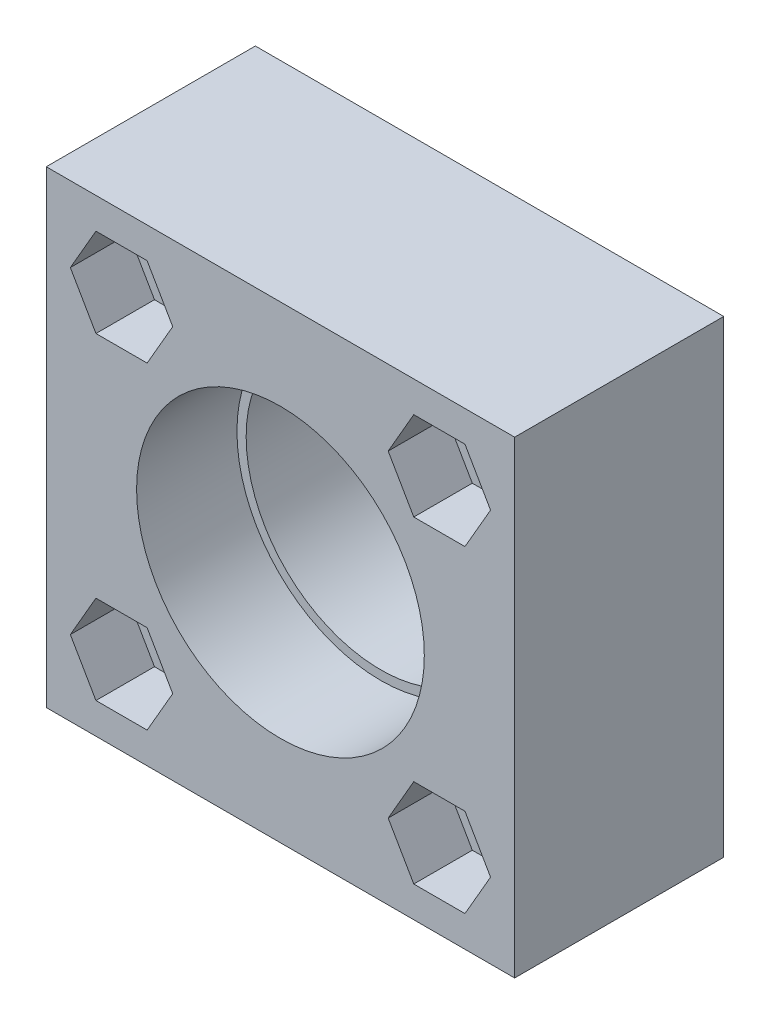
from build123d import *

# Parameters (mm, degrees)
CROQUIS1_W              = 28
CROQUIS1_H              = 28
CROQUIS1_R              = 8.05
SALIENTE_EXTRUIR1_DEPTH = 3.25
CROQUIS2_W              = 28
CROQUIS2_H              = 28
CROQUIS2_R              = 8.6
SALIENTE_EXTRUIR2_DEPTH = 6
CORTAR_EXTRUIR1_DEPTH   = 3.5
CROQUIS6_R              = 1.5
CORTAR_EXTRUIR2_DEPTH   = 23.5


with BuildPart() as part:
    # Croquis1 → Saliente-Extruir1 (new, symmetric)
    with BuildSketch(Plane.XY):
        Rectangle(CROQUIS1_W, CROQUIS1_H)
        Circle(CROQUIS1_R, mode=Mode.SUBTRACT)
    extrude(amount=SALIENTE_EXTRUIR1_DEPTH, both=True)

    # Croquis2 → Saliente-Extruir2 (add)
    with BuildSketch(Plane.XY.offset(3.25)):
        Rectangle(CROQUIS2_W, CROQUIS2_H)
        Circle(CROQUIS2_R, mode=Mode.SUBTRACT)
    extrude(amount=SALIENTE_EXTRUIR2_DEPTH)

    # Croquis3 → Cortar-Extruir1 (cut)
    with BuildSketch(Plane.XY.offset(9.25)):
        Polygon((11.029978213, 12.15), (7.970021787, 12.15), (6.440043573, 9.5), (7.970021787, 6.85), (11.029978213, 6.85), (12.559956427, 9.5), align=None)
        Polygon((-6.440043573, 9.5), (-7.970021787, 12.15), (-11.029978213, 12.15), (-12.559956427, 9.5), (-11.029978213, 6.85), (-7.970021787, 6.85), align=None)
        Polygon((-7.970021787, -6.85), (-11.029978213, -6.85), (-12.559956427, -9.5), (-11.029978213, -12.15), (-7.970021787, -12.15), (-6.440043573, -9.5), align=None)
        Polygon((11.029978213, -6.85), (7.970021787, -6.85), (6.440043573, -9.5), (7.970021787, -12.15), (11.029978213, -12.15), (12.559956427, -9.5), align=None)
    extrude(amount=-CORTAR_EXTRUIR1_DEPTH, mode=Mode.SUBTRACT)

    # Croquis6 → Cortar-Extruir2 (cut)
    with BuildSketch(Plane(origin=(0, 0, -3.25), x_dir=(-1, 0, 0), z_dir=(0, 0, -1))):
        with Locations((-9.5, 9.5)):
            Circle(CROQUIS6_R)
        with Locations((9.5, 9.5)):
            Circle(CROQUIS6_R)
        with Locations((9.5, -9.5)):
            Circle(CROQUIS6_R)
        with Locations((-9.5, -9.5)):
            Circle(CROQUIS6_R)
    extrude(amount=-CORTAR_EXTRUIR2_DEPTH, mode=Mode.SUBTRACT)


solid = part.part
